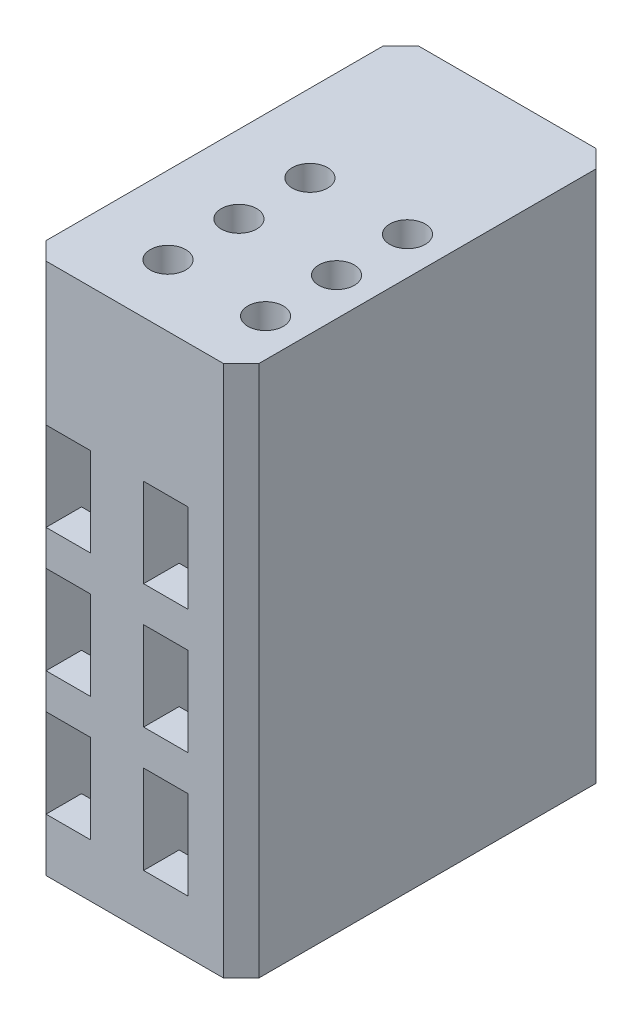
from build123d import *

# Parameters (mm, degrees)
EXTRUDE_1_DEPTH                  = 30
SKETCH_2_W                       = 4.5
SKETCH_2_H                       = 17
SKETCH_2_R                       = 1
EXTRUDE_2_DEPTH                  = 3
SKETCH_3_W                       = 2
SKETCH_3_H                       = 1
SKETCH_3_H_2                     = 6
EXTRUDE_3_DEPTH                  = 27
PATTERN_LINEAR_1_COUNT           = 2
PATTERN_LINEAR_1_PITCH           = 5.5
PATTERN_LINEAR_2_COUNT           = 2
PATTERN_LINEAR_2_PITCH           = 5.5
CUT_EXTRUDE_1_REACH              = 39.108
SKETCH_5_W                       = 2.5
SKETCH_5_H                       = 3
PATTERN_LINEAR_3_COUNT           = 3
PATTERN_LINEAR_3_PITCH           = 7
PATTERN_LINEAR_4_COPY_1_REACH    = 39.108
PATTERN_LINEAR_4_COPY_1_SKETCH_W = 2.5
PATTERN_LINEAR_4_COPY_1_SKETCH_H = 3
PATTERN_LINEAR_4_COPY_2_REACH    = 39.108
PATTERN_LINEAR_4_COPY_2_SKETCH_W = 2.5
PATTERN_LINEAR_4_COPY_2_SKETCH_H = 3
PATTERN_LINEAR_4_COPY_3_REACH    = 39.108
PATTERN_LINEAR_4_COPY_3_SKETCH_W = 2.5
PATTERN_LINEAR_4_COPY_3_SKETCH_H = 3
CUT_EXTRUDE_2_REACH              = 39.108
SKETCH_6_W                       = 2.5
SKETCH_6_H                       = 5
PATTERN_LINEAR_5_COUNT           = 3
PATTERN_LINEAR_5_PITCH           = 7
PATTERN_LINEAR_7_COPY_1_REACH    = 39.108
PATTERN_LINEAR_7_COPY_1_SKETCH_W = 2.5
PATTERN_LINEAR_7_COPY_1_SKETCH_H = 5
PATTERN_LINEAR_7_COPY_2_REACH    = 39.108
PATTERN_LINEAR_7_COPY_2_SKETCH_W = 2.5
PATTERN_LINEAR_7_COPY_2_SKETCH_H = 5
PATTERN_LINEAR_7_COPY_3_REACH    = 39.108
PATTERN_LINEAR_7_COPY_3_SKETCH_W = 2.5
PATTERN_LINEAR_7_COPY_3_SKETCH_H = 5


with BuildPart() as part:
    # Эскиз1 → Бобышка-Вытянуть1 (new body)
    with BuildSketch(Plane(origin=(0, 0, 0), x_dir=(1, 0, 0), z_dir=(0, 1, 0))):
        Polygon((5, 0), (-5, 0), (-6, 1), (-6, 10.5), (-5, 10.5), (-5, 2), (-0.5, 2), (-0.5, 10.5), (0.5, 10.5), (0.5, 2), (5, 2), (5, 10.5), (6, 10.5), (6, 1), align=None)
    extrude_1 = extrude(amount=EXTRUDE_1_DEPTH)

    # Зеркальное отражение1: Бобышка-Вытянуть1 across plane
    add(extrude_1.mirror(Plane(origin=(-0.5, 30, -10.5), x_dir=(1, 0, 0), z_dir=(0, 0, 1))))

    # Эскиз2 → Бобышка-Вытянуть2 (add)
    with BuildSketch(Plane(origin=(0, 30, 0), x_dir=(1, 0, 0), z_dir=(0, 1, 0))):
        with Locations((-2.75, 10.5)):
            Rectangle(SKETCH_2_W, SKETCH_2_H)
        with Locations((-1.625, 11.5)):
            Circle(SKETCH_2_R, mode=Mode.SUBTRACT)
        with Locations((-1.625, 7.5)):
            Circle(SKETCH_2_R, mode=Mode.SUBTRACT)
        with Locations((-1.625, 3.5)):
            Circle(SKETCH_2_R, mode=Mode.SUBTRACT)
    extrude_2 = extrude(amount=-EXTRUDE_2_DEPTH)

    # Эскиз3 → Бобышка-Вытянуть3 (add)
    with BuildSketch(Plane.XZ.offset(-27)):
        with Locations((-1.5, -5.5)):
            Rectangle(SKETCH_3_W, SKETCH_3_H)
        with Locations((-1.5, -9.5)):
            Rectangle(SKETCH_3_W, SKETCH_3_H)
        with Locations((-1.5, -16)):
            Rectangle(SKETCH_3_W, SKETCH_3_H_2)
    extrude_3 = extrude(amount=EXTRUDE_3_DEPTH)

    # Линейный массив1: Бобышка-Вытянуть2 ×2
    with Locations(*[(i * PATTERN_LINEAR_1_PITCH, 0, 0) for i in range(1, PATTERN_LINEAR_1_COUNT)]):
        add(extrude_2)

    # Линейный массив2: Бобышка-Вытянуть3 ×2
    with Locations(*[(i * PATTERN_LINEAR_2_PITCH, 0, 0) for i in range(1, PATTERN_LINEAR_2_COUNT)]):
        add(extrude_3)

    # Эскиз5 → Вырез-Вытянуть1 (cut, up to next)
    with BuildSketch(Plane(origin=(0, 0, -21), x_dir=(-1, 0, 0), z_dir=(0, 0, -1)), mode=Mode.PRIVATE) as cut_extrude_1_sk1:
        with Locations((3.75, 18.5)):
            Rectangle(SKETCH_5_W, SKETCH_5_H)
    cut_extrude_1_tool1 = extrude(cut_extrude_1_sk1.sketch, amount=-CUT_EXTRUDE_1_REACH, mode=Mode.PRIVATE) & part.part
    cut_extrude_1 = cut_extrude_1_tool1.solids().sort_by_distance((-3.75, 18.5, -21))[0]
    add(cut_extrude_1, mode=Mode.SUBTRACT)

    # Линейный массив3: Вырез-Вытянуть1 ×3
    with Locations(*[(0, -i * PATTERN_LINEAR_3_PITCH, 0) for i in range(1, PATTERN_LINEAR_3_COUNT)]):
        add(cut_extrude_1, mode=Mode.SUBTRACT)

    # Линейный массив4 copy 1 sketch → Линейный массив4 copy 1 (cut, up to next)
    with BuildSketch(Plane(origin=(5.5, -7, -21), x_dir=(-1, 0, 0), z_dir=(0, 0, -1)), mode=Mode.PRIVATE) as pattern_linear_4_copy_1_sk1:
        with Locations((3.75, 18.5)):
            Rectangle(PATTERN_LINEAR_4_COPY_1_SKETCH_W, PATTERN_LINEAR_4_COPY_1_SKETCH_H)
    pattern_linear_4_copy_1_tool1 = extrude(pattern_linear_4_copy_1_sk1.sketch, amount=-PATTERN_LINEAR_4_COPY_1_REACH, mode=Mode.PRIVATE) & part.part
    add(pattern_linear_4_copy_1_tool1.solids().sort_by_distance((1.75, 11.5, -21))[0], mode=Mode.SUBTRACT)

    # Линейный массив4 copy 2 sketch → Линейный массив4 copy 2 (cut, up to next)
    with BuildSketch(Plane(origin=(5.5, -14, -21), x_dir=(-1, 0, 0), z_dir=(0, 0, -1)), mode=Mode.PRIVATE) as pattern_linear_4_copy_2_sk1:
        with Locations((3.75, 18.5)):
            Rectangle(PATTERN_LINEAR_4_COPY_2_SKETCH_W, PATTERN_LINEAR_4_COPY_2_SKETCH_H)
    pattern_linear_4_copy_2_tool1 = extrude(pattern_linear_4_copy_2_sk1.sketch, amount=-PATTERN_LINEAR_4_COPY_2_REACH, mode=Mode.PRIVATE) & part.part
    add(pattern_linear_4_copy_2_tool1.solids().sort_by_distance((1.75, 4.5, -21))[0], mode=Mode.SUBTRACT)

    # Линейный массив4 copy 3 sketch → Линейный массив4 copy 3 (cut, up to next)
    with BuildSketch(Plane(origin=(5.5, 0, -21), x_dir=(-1, 0, 0), z_dir=(0, 0, -1)), mode=Mode.PRIVATE) as pattern_linear_4_copy_3_sk1:
        with Locations((3.75, 18.5)):
            Rectangle(PATTERN_LINEAR_4_COPY_3_SKETCH_W, PATTERN_LINEAR_4_COPY_3_SKETCH_H)
    pattern_linear_4_copy_3_tool1 = extrude(pattern_linear_4_copy_3_sk1.sketch, amount=-PATTERN_LINEAR_4_COPY_3_REACH, mode=Mode.PRIVATE) & part.part
    add(pattern_linear_4_copy_3_tool1.solids().sort_by_distance((1.75, 18.5, -21))[0], mode=Mode.SUBTRACT)

    # Эскиз6 → Вырез-Вытянуть2 (cut, up to next)
    with BuildSketch(Plane.XY, mode=Mode.PRIVATE) as cut_extrude_2_sk1:
        with Locations((-3.75, 19.5)):
            Rectangle(SKETCH_6_W, SKETCH_6_H)
    cut_extrude_2_tool1 = extrude(cut_extrude_2_sk1.sketch, amount=-CUT_EXTRUDE_2_REACH, mode=Mode.PRIVATE) & part.part
    cut_extrude_2 = cut_extrude_2_tool1.solids().sort_by_distance((-3.75, 19.5, 0))[0]
    add(cut_extrude_2, mode=Mode.SUBTRACT)

    # Линейный массив5: Вырез-Вытянуть2 ×3
    with Locations(*[(0, -i * PATTERN_LINEAR_5_PITCH, 0) for i in range(1, PATTERN_LINEAR_5_COUNT)]):
        add(cut_extrude_2, mode=Mode.SUBTRACT)

    # Линейный массив7 copy 1 sketch → Линейный массив7 copy 1 (cut, up to next)
    with BuildSketch(Plane(origin=(5.5, -7, 0), x_dir=(1, 0, 0), z_dir=(0, 0, 1)), mode=Mode.PRIVATE) as pattern_linear_7_copy_1_sk1:
        with Locations((-3.75, 19.5)):
            Rectangle(PATTERN_LINEAR_7_COPY_1_SKETCH_W, PATTERN_LINEAR_7_COPY_1_SKETCH_H)
    pattern_linear_7_copy_1_tool1 = extrude(pattern_linear_7_copy_1_sk1.sketch, amount=-PATTERN_LINEAR_7_COPY_1_REACH, mode=Mode.PRIVATE) & part.part
    add(pattern_linear_7_copy_1_tool1.solids().sort_by_distance((1.75, 12.5, 0))[0], mode=Mode.SUBTRACT)

    # Линейный массив7 copy 2 sketch → Линейный массив7 copy 2 (cut, up to next)
    with BuildSketch(Plane(origin=(5.5, -14, 0), x_dir=(1, 0, 0), z_dir=(0, 0, 1)), mode=Mode.PRIVATE) as pattern_linear_7_copy_2_sk1:
        with Locations((-3.75, 19.5)):
            Rectangle(PATTERN_LINEAR_7_COPY_2_SKETCH_W, PATTERN_LINEAR_7_COPY_2_SKETCH_H)
    pattern_linear_7_copy_2_tool1 = extrude(pattern_linear_7_copy_2_sk1.sketch, amount=-PATTERN_LINEAR_7_COPY_2_REACH, mode=Mode.PRIVATE) & part.part
    add(pattern_linear_7_copy_2_tool1.solids().sort_by_distance((1.75, 5.5, 0))[0], mode=Mode.SUBTRACT)

    # Линейный массив7 copy 3 sketch → Линейный массив7 copy 3 (cut, up to next)
    with BuildSketch(Plane(origin=(5.5, 0, 0), x_dir=(1, 0, 0), z_dir=(0, 0, 1)), mode=Mode.PRIVATE) as pattern_linear_7_copy_3_sk1:
        with Locations((-3.75, 19.5)):
            Rectangle(PATTERN_LINEAR_7_COPY_3_SKETCH_W, PATTERN_LINEAR_7_COPY_3_SKETCH_H)
    pattern_linear_7_copy_3_tool1 = extrude(pattern_linear_7_copy_3_sk1.sketch, amount=-PATTERN_LINEAR_7_COPY_3_REACH, mode=Mode.PRIVATE) & part.part
    add(pattern_linear_7_copy_3_tool1.solids().sort_by_distance((1.75, 19.5, 0))[0], mode=Mode.SUBTRACT)


solid = part.part
